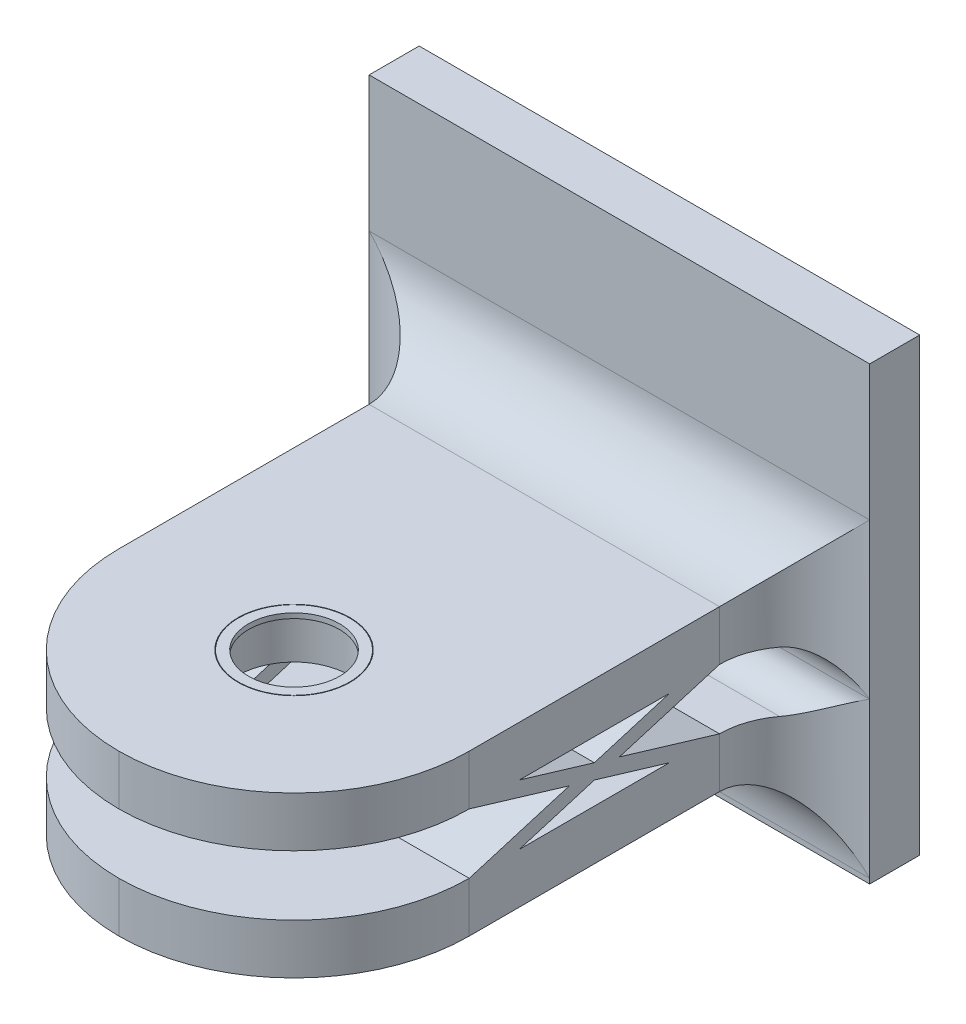
from build123d import *

# Parameters (mm, degrees)
ESQUISSE1_W             = 90
ESQUISSE1_H             = 100
BOSS_EXTRU_1_DEPTH      = 10
ESQUISSE2_W             = 70
ESQUISSE2_H             = 10
BOSS_EXTRU_2_DEPTH      = 100
CONG_1_R                = 35
ESQUISSE3_R             = 11.2
ENL_V_MAT_EXTRU_1_DEPTH = 208
CONG_2_R                = 15
ESQUISSE10_R            = 11.095538233
ESQUISSE10_R_2          = 9.095538233
BOSS_EXTRU_7_DEPTH      = 1
CONG_7_R                = 6
ESQUISSE15_R            = 11.095538233
ESQUISSE15_R_2          = 9.095538233
BOSS_EXTRU_11_DEPTH     = 0.5
BOSS_EXTRU_12_DEPTH     = 17
BOSS_EXTRU_13_DEPTH     = 17


with BuildPart() as part:
    # Esquisse1 → Boss.-Extru.1 (new body)
    with BuildSketch(Plane(origin=(0, 0, 0), x_dir=(0, 1, 0), z_dir=(0, 0, 1))):
        with Locations((45, 50)):
            Rectangle(ESQUISSE1_W, ESQUISSE1_H)
    extrude(amount=BOSS_EXTRU_1_DEPTH)

    # Esquisse2 → Boss.-Extru.2 (add)
    with BuildSketch(Plane.XY.offset(10)):
        with Locations((-50, 43)):
            Rectangle(ESQUISSE2_W, ESQUISSE2_H)
        with Locations((-50, 21)):
            Rectangle(ESQUISSE2_W, ESQUISSE2_H)
    extrude(amount=BOSS_EXTRU_2_DEPTH)

    # Congé1
    cong_1_edges = [part.edges().sort_by_distance(p)[0] for p in [
        (-15, 43, 110),
        (-85, 43, 110),
        (-15, 21, 110),
        (-85, 21, 110),
    ]]
    fillet(cong_1_edges, radius=CONG_1_R - 0.0001)  # a hair under: the kernel refuses the full size

    # Esquisse3 → Enlèv. mat.-Extru.1 (cut)
    with BuildSketch(Plane(origin=(0, 90, 0), x_dir=(-1, 0, 0), z_dir=(0, 1, 0))):
        with Locations((50, 75)):
            Circle(ESQUISSE3_R)
    extrude(amount=-ENL_V_MAT_EXTRU_1_DEPTH, mode=Mode.SUBTRACT)

    # Congé2
    cong_2_edges = [part.edges().sort_by_distance(p)[0] for p in [
        (-85, 43, 10),
        (-15, 43, 10),
        (-50, 48, 10),
        (-85, 21, 10),
        (-50, 16, 10),
        (-15, 21, 10),
    ]]
    fillet(cong_2_edges, radius=CONG_2_R - 0.0001)  # a hair under: the kernel refuses the full size

    # Congé7
    cong_7_edges = [part.edges().sort_by_distance(p)[0] for p in [
        (-50, 38, 10),
        (-50, 26, 10),
    ]]
    fillet(cong_7_edges, radius=CONG_7_R - 0.0001)  # a hair under: the kernel refuses the full size

    # Esquisse16 → Boss.-Extru.12 (add)
    with BuildSketch(Plane.YZ.offset(-15)):
        Polygon((26, 25), (26, 35), (38, 75), (38, 65), align=None)
    boss_extru_12 = extrude(amount=-BOSS_EXTRU_12_DEPTH)

    # Esquisse17 → Boss.-Extru.13 (add)
    with BuildSketch(Plane.YZ.offset(-15)):
        Polygon((26, 75), (26, 65), (38, 25), (38, 35), align=None)
    boss_extru_13 = extrude(amount=-BOSS_EXTRU_13_DEPTH)

    # Symétrie1: Boss.-Extru.12, Boss.-Extru.13 across plane
    add(boss_extru_12.mirror(Plane.ZY.offset(50)))
    add(boss_extru_13.mirror(Plane.ZY.offset(50)))


with BuildPart() as body_2:
    # Esquisse10 → Boss.-Extru.7 (new body)
    with BuildSketch(Plane(origin=(0, 48, 0), x_dir=(-1, 0, 0), z_dir=(0, 1, 0))):
        with Locations((50, 75)):
            Circle(ESQUISSE10_R)
        with Locations((50, 75)):
            Circle(ESQUISSE10_R_2, mode=Mode.SUBTRACT)
    extrude(amount=-BOSS_EXTRU_7_DEPTH)


with BuildPart() as body_3:
    # Esquisse15 → Boss.-Extru.11 (new body)
    with BuildSketch(Plane(origin=(0, 26, 0), x_dir=(-1, 0, 0), z_dir=(0, 1, 0))):
        with Locations((50, 75)):
            Circle(ESQUISSE15_R)
        with Locations((50, 75)):
            Circle(ESQUISSE15_R_2, mode=Mode.SUBTRACT)
    extrude(amount=-BOSS_EXTRU_11_DEPTH)


solid = Compound([part.part, body_2.part, body_3.part])
